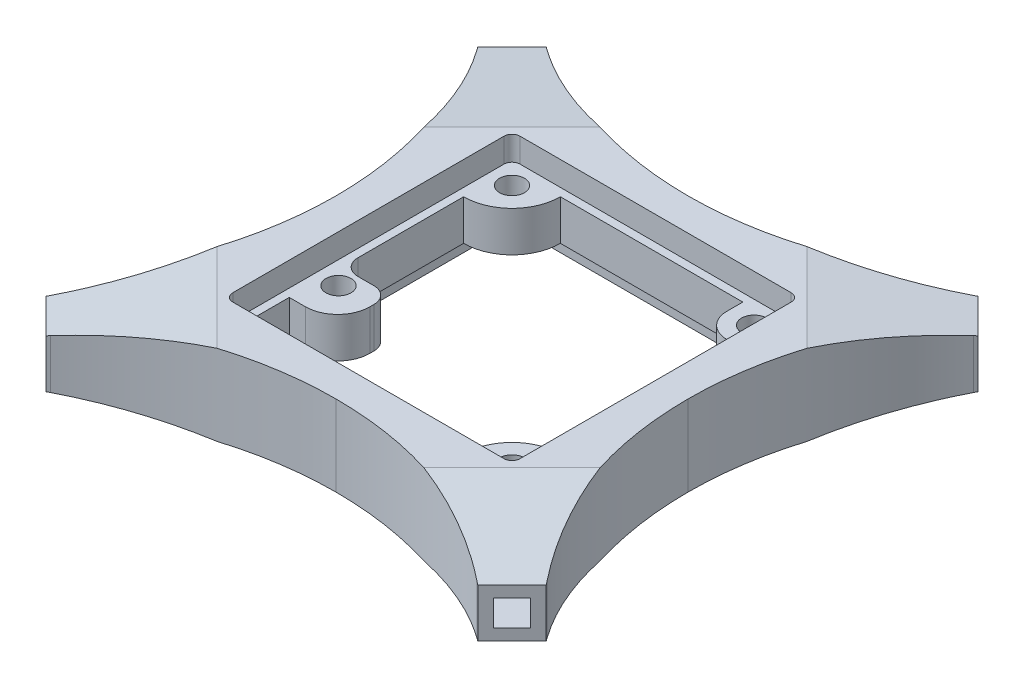
from build123d import *

# Parameters (mm, degrees)
ESQUISSE1_W                   = 43.6
ESQUISSE1_H                   = 43.6
ESQUISSE1_W_2                 = 35.6
ESQUISSE1_H_2                 = 35.6
BOSS_EXTRU_1_DEPTH            = 10
ESQUISSE2_W                   = 3.2
ESQUISSE2_H                   = 3.2
ENL_V_MAT_EXTRU_1_DEPTH       = 15
CHANFREIN1_SIZE               = 15
CHANFREIN1_SIZE_2             = 2
R_P_TITION_CIRCULAIRE10_COUNT = 4
BOSS_EXTRU_3_START            = -2
ESQUISSE6_W                   = 6
ESQUISSE6_H                   = 6.5
ESQUISSE6_R                   = 1.55
ESQUISSE6_H_2                 = 6
ESQUISSE6_W_2                 = 5
ESQUISSE6_H_3                 = 5
ESQUISSE6_W_3                 = 1
ESQUISSE6_H_4                 = 22.6
ESQUISSE6_H_5                 = 15.1
ESQUISSE6_W_4                 = 22.6
ESQUISSE6_H_6                 = 1
BOSS_EXTRU_3_DEPTH            = 5
CONG_1_R                      = 6
CONG_2_R                      = 3
CONG_3_R                      = 4
CONG_4_R                      = 2
CONG_8_R                      = 1
CONG_9_R                      = 43.5
CONG_10_R                     = 2


# Some blends are built 0.0001 mm under size
with BuildPart() as part:
    # Esquisse1 → Boss.-Extru.1 (new body)
    # profile 1 of 5: a face of its own
    with BuildSketch(Plane(origin=(0, 0, 0), x_dir=(1, 0, 0), z_dir=(0, 1, 0))):
        Rectangle(ESQUISSE1_W, ESQUISSE1_H)
        Rectangle(ESQUISSE1_W_2, ESQUISSE1_H_2, mode=Mode.SUBTRACT)
    # profile 2 of 5: a face of its own
    with BuildSketch(Plane(origin=(0, 0, 0), x_dir=(1, 0, 0), z_dir=(0, 1, 0))):
        Polygon((32.406601718, -25.335533906), (21.8, -14.728932188), (21.8, -21.8), (14.728932188, -21.8), (25.335533906, -32.406601718), align=None)
    # profile 3 of 5: a face of its own
    with BuildSketch(Plane(origin=(0, 0, 0), x_dir=(1, 0, 0), z_dir=(0, 1, 0))):
        Polygon((21.8, 21.8), (21.8, 14.728932188), (32.406601718, 25.335533906), (25.335533906, 32.406601718), (14.728932188, 21.8), align=None)
    # profile 4 of 5: a face of its own
    with BuildSketch(Plane(origin=(0, 0, 0), x_dir=(1, 0, 0), z_dir=(0, 1, 0))):
        Polygon((-21.8, 21.8), (-14.728932188, 21.8), (-25.335533906, 32.406601718), (-32.406601718, 25.335533906), (-21.8, 14.728932188), align=None)
    # profile 5 of 5: a face of its own
    with BuildSketch(Plane(origin=(0, 0, 0), x_dir=(1, 0, 0), z_dir=(0, 1, 0))):
        Polygon((-25.335533906, -32.406601718), (-14.728932188, -21.8), (-21.8, -21.8), (-21.8, -14.728932188), (-32.406601718, -25.335533906), align=None)
    extrude(amount=BOSS_EXTRU_1_DEPTH)

    # Esquisse2 → Enlèv. mat.-Extru.1 (cut)
    with BuildSketch(Plane(origin=(28.871067812, 0, 28.871067812), x_dir=(0.7071067811865475, 0, -0.7071067811865477), z_dir=(0.7071067811865477, 0, 0.7071067811865475))):
        with Locations((0, 5)):
            Rectangle(ESQUISSE2_W, ESQUISSE2_H)
    enl_v_mat_extru_1 = extrude(amount=-ENL_V_MAT_EXTRU_1_DEPTH, mode=Mode.SUBTRACT)

    # Chanfrein1
    # the kernel refuses this chamfer: 15, 2 mm, written as the material it takes off along each edge
    with BuildSketch(Plane(origin=(-2.232682747, 0, 59.974818371), x_dir=(-0.7070976396858032, -0.0050848698637449155, -0.7070976396858037), z_dir=(0.7071067811865478, 0, -0.7071067811865474)), Plane(origin=(59.974818371, 0, 2.232682747), x_dir=(-0.7070976396858033, -0.005084869863744911, 0.7070976396858037), z_dir=(-0.7071067811865477, 0, -0.7071067811865474)), Plane(origin=(2.232682747, 0, -59.974818371), x_dir=(0.7070976396858034, -0.005084869863744912, 0.7070976396858035), z_dir=(-0.7071067811865476, 0, 0.7071067811865476)), Plane(origin=(-59.974818371, 0, -2.232682747), x_dir=(0.7070976396858035, -0.005084869863744911, -0.7070976396858034), z_dir=(0.7071067811865476, 0, 0.7071067811865476))) as chanfrein1_piece_1:
        Polygon((CHANFREIN1_SIZE * 0.999987071966, CHANFREIN1_SIZE * 0.00508486986374), (-CHANFREIN1_SIZE_2 * 0.00508486986374, CHANFREIN1_SIZE_2 * 0.999987071966), (0, 0), align=None)
    extrude(amount=87.974691762, mode=Mode.SUBTRACT)
    with BuildSketch(Plane(origin=(-2.232682747, 10, 59.974818371), x_dir=(-0.7070976396858032, 0.005084869863744968, -0.7070976396858037), z_dir=(0.7071067811865478, 0, -0.7071067811865474)), Plane(origin=(59.974818371, 10, 2.232682747), x_dir=(-0.7070976396858033, 0.005084869863744967, 0.7070976396858037), z_dir=(-0.7071067811865477, 0, -0.7071067811865474)), Plane(origin=(2.232682747, 10, -59.974818371), x_dir=(0.7070976396858034, 0.005084869863744967, 0.7070976396858035), z_dir=(-0.7071067811865476, 0, 0.7071067811865476)), Plane(origin=(-59.974818371, 10, -2.232682747), x_dir=(0.7070976396858035, 0.005084869863744967, -0.7070976396858034), z_dir=(0.7071067811865476, 0, 0.7071067811865476))) as chanfrein1_piece_2:
        Polygon((CHANFREIN1_SIZE * 0.999987071966, -CHANFREIN1_SIZE * 0.00508486986374), (-CHANFREIN1_SIZE_2 * 0.00508486986374, -CHANFREIN1_SIZE_2 * 0.999987071966), (0, 0), align=None)
    extrude(amount=87.974691762, mode=Mode.SUBTRACT)
    with BuildSketch(Plane(origin=(25.335533906, -38.987345881, 32.406601718), x_dir=(-0.7106931856479084, 0, -0.7035020937236985), z_dir=(0, 1, 0))) as chanfrein1_piece_3_section:
        Polygon((CHANFREIN1_SIZE * 0.999987071966, -CHANFREIN1_SIZE * 0.00508486986374), (-CHANFREIN1_SIZE_2 * 0.00508486986374, -CHANFREIN1_SIZE_2 * 0.999987071966), (0, 0), align=None)
    chanfrein1_piece_3 = extrude(amount=87.974691762, mode=Mode.PRIVATE)
    chanfrein1_piece_3 = split(chanfrein1_piece_3, bisect_by=Plane(origin=(21.834036331, 5, 21.8), z_dir=(0, 0, 1)), keep=Keep.TOP, mode=Mode.PRIVATE)
    add(chanfrein1_piece_3, mode=Mode.SUBTRACT)
    with BuildSketch(Plane(origin=(32.406601718, -38.987345881, 25.335533906), x_dir=(-0.48538969413478916, 0, 0.8742979153742365), z_dir=(0, 1, 0))) as chanfrein1_piece_4_section:
        Polygon((CHANFREIN1_SIZE_2 * 0.961444328979, -CHANFREIN1_SIZE_2 * 0.274999640498), (-CHANFREIN1_SIZE * 0.274999640498, -CHANFREIN1_SIZE * 0.961444328979), (0, 0), align=None)
    chanfrein1_piece_4 = extrude(amount=87.974691762, mode=Mode.PRIVATE)
    chanfrein1_piece_4 = split(chanfrein1_piece_4, bisect_by=Plane(origin=(21.8, 5, 21.834036331), z_dir=(1, 0, 0)), keep=Keep.TOP, mode=Mode.PRIVATE)
    add(chanfrein1_piece_4, mode=Mode.SUBTRACT)
    with BuildSketch(Plane(origin=(32.406601718, -38.987345881, -25.335533906), x_dir=(-0.7035020937236987, 0, 0.7106931856479084), z_dir=(0, 1, 0))) as chanfrein1_piece_5_section:
        Polygon((CHANFREIN1_SIZE * 0.999987071966, -CHANFREIN1_SIZE * 0.00508486986374), (-CHANFREIN1_SIZE_2 * 0.00508486986374, -CHANFREIN1_SIZE_2 * 0.999987071966), (0, 0), align=None)
    chanfrein1_piece_5 = extrude(amount=87.974691762, mode=Mode.PRIVATE)
    chanfrein1_piece_5 = split(chanfrein1_piece_5, bisect_by=Plane(origin=(21.8, 5, -21.834036331), z_dir=(1, 0, 0)), keep=Keep.TOP, mode=Mode.PRIVATE)
    add(chanfrein1_piece_5, mode=Mode.SUBTRACT)
    with BuildSketch(Plane(origin=(25.335533906, -38.987345881, -32.406601718), x_dir=(0.874297915374238, 0, 0.48538969413478666), z_dir=(0, 1, 0))) as chanfrein1_piece_6_section:
        Polygon((CHANFREIN1_SIZE_2 * 0.961444328979, -CHANFREIN1_SIZE_2 * 0.274999640498), (-CHANFREIN1_SIZE * 0.274999640498, -CHANFREIN1_SIZE * 0.961444328979), (0, 0), align=None)
    chanfrein1_piece_6 = extrude(amount=87.974691762, mode=Mode.PRIVATE)
    chanfrein1_piece_6 = split(chanfrein1_piece_6, bisect_by=Plane(origin=(21.834036331, 5, -21.8), z_dir=(0, 0, -1)), keep=Keep.TOP, mode=Mode.PRIVATE)
    add(chanfrein1_piece_6, mode=Mode.SUBTRACT)
    with BuildSketch(Plane(origin=(-25.335533906, -38.987345881, -32.406601718), x_dir=(0.7106931856479084, 0, 0.7035020937236987), z_dir=(0, 1, 0))) as chanfrein1_piece_7_section:
        Polygon((CHANFREIN1_SIZE * 0.999987071966, -CHANFREIN1_SIZE * 0.00508486986375), (-CHANFREIN1_SIZE_2 * 0.00508486986374, -CHANFREIN1_SIZE_2 * 0.999987071966), (0, 0), align=None)
    chanfrein1_piece_7 = extrude(amount=87.974691762, mode=Mode.PRIVATE)
    chanfrein1_piece_7 = split(chanfrein1_piece_7, bisect_by=Plane(origin=(-21.834036331, 5, -21.8), z_dir=(0, 0, -1)), keep=Keep.TOP, mode=Mode.PRIVATE)
    add(chanfrein1_piece_7, mode=Mode.SUBTRACT)
    with BuildSketch(Plane(origin=(-32.406601718, -38.987345881, -25.335533906), x_dir=(0.48538969413478794, 0, -0.8742979153742373), z_dir=(0, 1, 0))) as chanfrein1_piece_8_section:
        Polygon((CHANFREIN1_SIZE_2 * 0.961444328979, -CHANFREIN1_SIZE_2 * 0.274999640498), (-CHANFREIN1_SIZE * 0.274999640498, -CHANFREIN1_SIZE * 0.961444328979), (0, 0), align=None)
    chanfrein1_piece_8 = extrude(amount=87.974691762, mode=Mode.PRIVATE)
    chanfrein1_piece_8 = split(chanfrein1_piece_8, bisect_by=Plane(origin=(-21.8, 5, -21.834036331), z_dir=(-1, 0, 0)), keep=Keep.TOP, mode=Mode.PRIVATE)
    add(chanfrein1_piece_8, mode=Mode.SUBTRACT)
    with BuildSketch(Plane(origin=(-32.406601718, -38.987345881, 25.335533906), x_dir=(0.7035020937236987, 0, -0.7106931856479084), z_dir=(0, 1, 0))) as chanfrein1_piece_9_section:
        Polygon((CHANFREIN1_SIZE * 0.999987071966, -CHANFREIN1_SIZE * 0.00508486986374), (-CHANFREIN1_SIZE_2 * 0.00508486986374, -CHANFREIN1_SIZE_2 * 0.999987071966), (0, 0), align=None)
    chanfrein1_piece_9 = extrude(amount=87.974691762, mode=Mode.PRIVATE)
    chanfrein1_piece_9 = split(chanfrein1_piece_9, bisect_by=Plane(origin=(-21.8, 5, 21.834036331), z_dir=(-1, 0, 0)), keep=Keep.TOP, mode=Mode.PRIVATE)
    add(chanfrein1_piece_9, mode=Mode.SUBTRACT)
    with BuildSketch(Plane(origin=(-25.335533906, -38.987345881, 32.406601718), x_dir=(0.7106931856479087, 0, -0.7035020937236982), z_dir=(0, 1, 0))) as chanfrein1_piece_10_section:
        Polygon((CHANFREIN1_SIZE * 0.999987071966, CHANFREIN1_SIZE * 0.00508486986374), (-CHANFREIN1_SIZE_2 * 0.00508486986375, CHANFREIN1_SIZE_2 * 0.999987071966), (0, 0), align=None)
    chanfrein1_piece_10 = extrude(amount=87.974691762, mode=Mode.PRIVATE)
    chanfrein1_piece_10 = split(chanfrein1_piece_10, bisect_by=Plane(origin=(-21.834036331, 5, 21.8), z_dir=(0, 0, 1)), keep=Keep.TOP, mode=Mode.PRIVATE)
    add(chanfrein1_piece_10, mode=Mode.SUBTRACT)

    # Répétition circulaire10: Enlèv. mat.-Extru.1 ×4 about axis
    r_p_tition_circulaire10_axis = Axis((0, 0, 0), (0, 1, 0))
    for i in range(1, R_P_TITION_CIRCULAIRE10_COUNT):
        add(enl_v_mat_extru_1.rotate(r_p_tition_circulaire10_axis, i * 360 / R_P_TITION_CIRCULAIRE10_COUNT), mode=Mode.SUBTRACT)

    # Esquisse6 → Boss.-Extru.3 (add)
    # profile 1 of 12: a face of its own
    with BuildSketch(Plane.XZ.offset(BOSS_EXTRU_3_START)):
        with Locations((-13.8, 7.55)):
            Rectangle(ESQUISSE6_W, ESQUISSE6_H)
        with Locations(Location((-15.012694945, 6.487348235, 0), (0, 0, 270))):
            Circle(ESQUISSE6_R, mode=Mode.SUBTRACT)
    # profile 2 of 12: a face of its own
    with BuildSketch(Plane.XZ.offset(BOSS_EXTRU_3_START)):
        with Locations((-13.8, -13.8)):
            Rectangle(ESQUISSE6_W, ESQUISSE6_H_2)
        with Locations(Location((-15.012694945, -15.012694945, 0), (0, 0, 270))):
            Circle(ESQUISSE6_R, mode=Mode.SUBTRACT)
    # profile 3 of 12: a face of its own
    with BuildSketch(Plane.XZ.offset(BOSS_EXTRU_3_START)):
        with Locations((14.3, -14.3)):
            Rectangle(ESQUISSE6_W_2, ESQUISSE6_H_3)
        with Locations(Location((14.987366015, -15.012694945, 0), (0, 0, 270))):
            Circle(ESQUISSE6_R, mode=Mode.SUBTRACT)
    # profile 4 of 12: a face of its own
    with BuildSketch(Plane.XZ.offset(BOSS_EXTRU_3_START)):
        Polygon((17.8, -17.8), (17.8, -11.8), (16.8, -11.8), (16.8, -16.8), (11.8, -16.8), (11.8, -17.8), align=None)
    # profile 5 of 12: a face of its own
    with BuildSketch(Plane.XZ.offset(BOSS_EXTRU_3_START)):
        Polygon((-16.8, -10.8), (-17.8, -10.8), (-17.8, -17.8), (-10.8, -17.8), (-10.8, -16.8), (-16.8, -16.8), align=None)
    # profile 6 of 12: a face of its own
    with BuildSketch(Plane.XZ.offset(BOSS_EXTRU_3_START)):
        with Locations((-17.3, 7.55)):
            Rectangle(ESQUISSE6_W_3, ESQUISSE6_H)
    # profile 7 of 12: a face of its own
    with BuildSketch(Plane.XZ.offset(BOSS_EXTRU_3_START)):
        Polygon((17.8, 10.8), (17.8, 17.8), (10.8, 17.8), (10.8, 16.8), (16.8, 16.8), (16.8, 10.8), align=None)
    # profile 8 of 12: a face of its own
    with BuildSketch(Plane.XZ.offset(BOSS_EXTRU_3_START)):
        with Locations((17.3, -0.5)):
            Rectangle(ESQUISSE6_W_3, ESQUISSE6_H_4)
    # profile 9 of 12: a face of its own
    with BuildSketch(Plane.XZ.offset(BOSS_EXTRU_3_START)):
        Polygon((10.8, 16.8), (10.8, 17.8), (-17.8, 17.8), (-17.8, 10.8), (-16.8, 10.8), (-16.8, 16.8), align=None)
    # profile 10 of 12: a face of its own
    with BuildSketch(Plane.XZ.offset(BOSS_EXTRU_3_START)):
        with Locations((-17.3, -3.25)):
            Rectangle(ESQUISSE6_W_3, ESQUISSE6_H_5)
    # profile 11 of 12: a face of its own
    with BuildSketch(Plane.XZ.offset(BOSS_EXTRU_3_START)):
        with Locations((0.5, -17.3)):
            Rectangle(ESQUISSE6_W_4, ESQUISSE6_H_6)
    # profile 12 of 12: a face of its own
    with BuildSketch(Plane.XZ.offset(BOSS_EXTRU_3_START)):
        with Locations((13.8, 13.8)):
            Rectangle(ESQUISSE6_W, ESQUISSE6_H_2)
        with Locations(Location((14.987366015, 14.987366015, 0), (0, 0, 270))):
            Circle(ESQUISSE6_R, mode=Mode.SUBTRACT)
    extrude(amount=-BOSS_EXTRU_3_DEPTH)

    # Congé1
    cong_1_edges = [part.edges().sort_by_distance(p)[0] for p in [
        (-10.8, 4.5, -10.8),
        (10.8, 4.5, 10.8),
    ]]
    fillet(cong_1_edges, radius=CONG_1_R - 0.0001)  # a hair under: the kernel refuses the full size

    # Congé2
    cong_2_edges = [part.edges().sort_by_distance(p)[0] for p in [
        (11.8, 4.5, -11.8),
    ]]
    fillet(cong_2_edges, radius=CONG_2_R)

    # Congé3
    cong_3_edges = [part.edges().sort_by_distance(p)[0] for p in [
        (-10.8, 4.5, 10.8),
    ]]
    fillet(cong_3_edges, radius=CONG_3_R)

    # Congé4
    cong_4_edges = [part.edges().sort_by_distance(p)[0] for p in [
        (-10.8, 4.5, 4.3),
    ]]
    fillet(cong_4_edges, radius=CONG_4_R)

    # Congé8
    cong_8_edges = [part.edges().sort_by_distance(p)[0] for p in [
        (17.8, 1, -17.8),
        (-17.8, 1, -17.8),
        (-17.8, 1, 17.8),
        (17.8, 1, 17.8),
        (17.8, 8.5, -17.8),
        (-17.8, 8.5, -17.8),
        (-17.8, 8.5, 17.8),
        (17.8, 8.5, 17.8),
    ]]
    fillet(cong_8_edges, radius=CONG_8_R)

    # Congé9
    # the kernel refuses this fillet: 43.5 mm, written as the material it adds along each edge
    with BuildSketch(Plane(origin=(-21.8, 0, 14.728932188), x_dir=(0, 0, -1), z_dir=(0, 1, 0))) as cong_9_piece_1_section:
        with BuildLine():
            CenterArc((CONG_9_R * 0.338533427618, CONG_9_R), CONG_9_R, 232.594643369, 37.405356631)
            Line((-CONG_9_R * 0.268916679953, CONG_9_R * 0.205642167023), (0, 0))
            Line((0, 0), (CONG_9_R * 0.338533427618, 0))
        make_face()
    cong_9_piece_1 = extrude(amount=10, mode=Mode.PRIVATE)
    cong_9_piece_1 = split(cong_9_piece_1, bisect_by=Plane(origin=(-23.815811659, 0.117652919, 13.961018177), z_dir=(0.09345386270338202, 0.9912279006826004, -0.09345386270338202)), keep=Keep.TOP, mode=Mode.PRIVATE)
    cong_9_piece_1 = split(cong_9_piece_1, bisect_by=Plane(origin=(-23.815811659, 9.882347081, 13.961018177), z_dir=(0.09345386270338202, -0.9912279006826004, -0.09345386270338202)), keep=Keep.TOP, mode=Mode.PRIVATE)
    add(cong_9_piece_1)
    with BuildSketch(Plane(origin=(-21.8, 0, -14.728932188), x_dir=(0, 0, 1), z_dir=(0, 1, 0))) as cong_9_piece_2_section:
        with BuildLine():
            CenterArc((CONG_9_R * 0.338533427618, -CONG_9_R), CONG_9_R, 90, 37.405356631)
            Line((-CONG_9_R * 0.268916679952, -CONG_9_R * 0.205642167022), (0, 0))
            Line((0, 0), (CONG_9_R * 0.338533427618, 0))
        make_face()
    cong_9_piece_2 = extrude(amount=10, mode=Mode.PRIVATE)
    cong_9_piece_2 = split(cong_9_piece_2, bisect_by=Plane(origin=(-23.815811659, 0.117652919, -13.961018177), z_dir=(0.09345386270338202, 0.9912279006826004, 0.09345386270338202)), keep=Keep.TOP, mode=Mode.PRIVATE)
    cong_9_piece_2 = split(cong_9_piece_2, bisect_by=Plane(origin=(-23.815811659, 9.882347081, -13.961018177), z_dir=(0.09345386270338202, -0.9912279006826004, 0.09345386270338202)), keep=Keep.TOP, mode=Mode.PRIVATE)
    add(cong_9_piece_2)
    with BuildSketch(Plane(origin=(-14.728932188, 0, -21.8), x_dir=(1, 0, 0), z_dir=(0, 1, 0))) as cong_9_piece_3_section:
        with BuildLine():
            CenterArc((CONG_9_R * 0.338533427618, CONG_9_R), CONG_9_R, 232.594643369, 37.405356631)
            Line((-CONG_9_R * 0.268916679953, CONG_9_R * 0.205642167023), (0, 0))
            Line((0, 0), (CONG_9_R * 0.338533427618, 0))
        make_face()
    cong_9_piece_3 = extrude(amount=10, mode=Mode.PRIVATE)
    cong_9_piece_3 = split(cong_9_piece_3, bisect_by=Plane(origin=(-13.961018177, 0.117652919, -23.815811659), z_dir=(0.09345386270338202, 0.9912279006826004, 0.09345386270338202)), keep=Keep.TOP, mode=Mode.PRIVATE)
    cong_9_piece_3 = split(cong_9_piece_3, bisect_by=Plane(origin=(-13.961018177, 9.882347081, -23.815811659), z_dir=(0.09345386270338202, -0.9912279006826004, 0.09345386270338202)), keep=Keep.TOP, mode=Mode.PRIVATE)
    add(cong_9_piece_3)
    with BuildSketch(Plane(origin=(14.728932188, 0, -21.8), x_dir=(-1, 0, 0), z_dir=(0, 1, 0))) as cong_9_piece_4_section:
        with BuildLine():
            CenterArc((CONG_9_R * 0.338533427618, -CONG_9_R), CONG_9_R, 90, 37.405356631)
            Line((-CONG_9_R * 0.268916679952, -CONG_9_R * 0.205642167022), (0, 0))
            Line((0, 0), (CONG_9_R * 0.338533427618, 0))
        make_face()
    cong_9_piece_4 = extrude(amount=10, mode=Mode.PRIVATE)
    cong_9_piece_4 = split(cong_9_piece_4, bisect_by=Plane(origin=(13.961018177, 0.117652919, -23.815811659), z_dir=(-0.09345386270338202, 0.9912279006826004, 0.09345386270338202)), keep=Keep.TOP, mode=Mode.PRIVATE)
    cong_9_piece_4 = split(cong_9_piece_4, bisect_by=Plane(origin=(13.961018177, 9.882347081, -23.815811659), z_dir=(-0.09345386270338202, -0.9912279006826004, 0.09345386270338202)), keep=Keep.TOP, mode=Mode.PRIVATE)
    add(cong_9_piece_4)
    with BuildSketch(Plane(origin=(21.8, 0, -14.728932188), x_dir=(0, 0, 1), z_dir=(0, 1, 0))) as cong_9_piece_5_section:
        with BuildLine():
            CenterArc((CONG_9_R * 0.338533427618, CONG_9_R), CONG_9_R, 232.594643369, 37.405356631)
            Line((-CONG_9_R * 0.268916679953, CONG_9_R * 0.205642167023), (0, 0))
            Line((0, 0), (CONG_9_R * 0.338533427618, 0))
        make_face()
    cong_9_piece_5 = extrude(amount=10, mode=Mode.PRIVATE)
    cong_9_piece_5 = split(cong_9_piece_5, bisect_by=Plane(origin=(23.815811659, 0.117652919, -13.961018177), z_dir=(-0.09345386270338202, 0.9912279006826004, 0.09345386270338202)), keep=Keep.TOP, mode=Mode.PRIVATE)
    cong_9_piece_5 = split(cong_9_piece_5, bisect_by=Plane(origin=(23.815811659, 9.882347081, -13.961018177), z_dir=(-0.09345386270338202, -0.9912279006826004, 0.09345386270338202)), keep=Keep.TOP, mode=Mode.PRIVATE)
    add(cong_9_piece_5)
    with BuildSketch(Plane(origin=(21.8, 0, 14.728932188), x_dir=(0, 0, -1), z_dir=(0, 1, 0))) as cong_9_piece_6_section:
        with BuildLine():
            CenterArc((CONG_9_R * 0.338533427618, -CONG_9_R), CONG_9_R, 90, 37.405356631)
            Line((-CONG_9_R * 0.268916679952, -CONG_9_R * 0.205642167022), (0, 0))
            Line((0, 0), (CONG_9_R * 0.338533427618, 0))
        make_face()
    cong_9_piece_6 = extrude(amount=10, mode=Mode.PRIVATE)
    cong_9_piece_6 = split(cong_9_piece_6, bisect_by=Plane(origin=(23.815811659, 0.117652919, 13.961018177), z_dir=(-0.09345386270338202, 0.9912279006826004, -0.09345386270338202)), keep=Keep.TOP, mode=Mode.PRIVATE)
    cong_9_piece_6 = split(cong_9_piece_6, bisect_by=Plane(origin=(23.815811659, 9.882347081, 13.961018177), z_dir=(-0.09345386270338202, -0.9912279006826004, -0.09345386270338202)), keep=Keep.TOP, mode=Mode.PRIVATE)
    add(cong_9_piece_6)
    with BuildSketch(Plane(origin=(14.728932188, 0, 21.8), x_dir=(-1, 0, 0), z_dir=(0, 1, 0))) as cong_9_piece_7_section:
        with BuildLine():
            CenterArc((CONG_9_R * 0.338533427618, CONG_9_R), CONG_9_R, 232.594643369, 37.405356631)
            Line((-CONG_9_R * 0.268916679953, CONG_9_R * 0.205642167023), (0, 0))
            Line((0, 0), (CONG_9_R * 0.338533427618, 0))
        make_face()
    cong_9_piece_7 = extrude(amount=10, mode=Mode.PRIVATE)
    cong_9_piece_7 = split(cong_9_piece_7, bisect_by=Plane(origin=(13.961018177, 0.117652919, 23.815811659), z_dir=(-0.09345386270338202, 0.9912279006826004, -0.09345386270338202)), keep=Keep.TOP, mode=Mode.PRIVATE)
    cong_9_piece_7 = split(cong_9_piece_7, bisect_by=Plane(origin=(13.961018177, 9.882347081, 23.815811659), z_dir=(-0.09345386270338202, -0.9912279006826004, -0.09345386270338202)), keep=Keep.TOP, mode=Mode.PRIVATE)
    add(cong_9_piece_7)
    with BuildSketch(Plane(origin=(-14.728932188, 0, 21.8), x_dir=(1, 0, 0), z_dir=(0, 1, 0))) as cong_9_piece_8_section:
        with BuildLine():
            CenterArc((CONG_9_R * 0.338533427618, -CONG_9_R), CONG_9_R, 90, 37.405356631)
            Line((-CONG_9_R * 0.268916679953, -CONG_9_R * 0.205642167023), (0, 0))
            Line((0, 0), (CONG_9_R * 0.338533427618, 0))
        make_face()
    cong_9_piece_8 = extrude(amount=10, mode=Mode.PRIVATE)
    cong_9_piece_8 = split(cong_9_piece_8, bisect_by=Plane(origin=(-13.961018177, 0.117652919, 23.815811659), z_dir=(0.09345386270338202, 0.9912279006826004, -0.09345386270338202)), keep=Keep.TOP, mode=Mode.PRIVATE)
    cong_9_piece_8 = split(cong_9_piece_8, bisect_by=Plane(origin=(-13.961018177, 9.882347081, 23.815811659), z_dir=(0.09345386270338202, -0.9912279006826004, -0.09345386270338202)), keep=Keep.TOP, mode=Mode.PRIVATE)
    add(cong_9_piece_8)

    # Congé10
    cong_10_edges = [part.edges().sort_by_distance(p)[0] for p in [
        (-16.8, 4.5, 4.3),
    ]]
    fillet(cong_10_edges, radius=CONG_10_R)


solid = part.part
